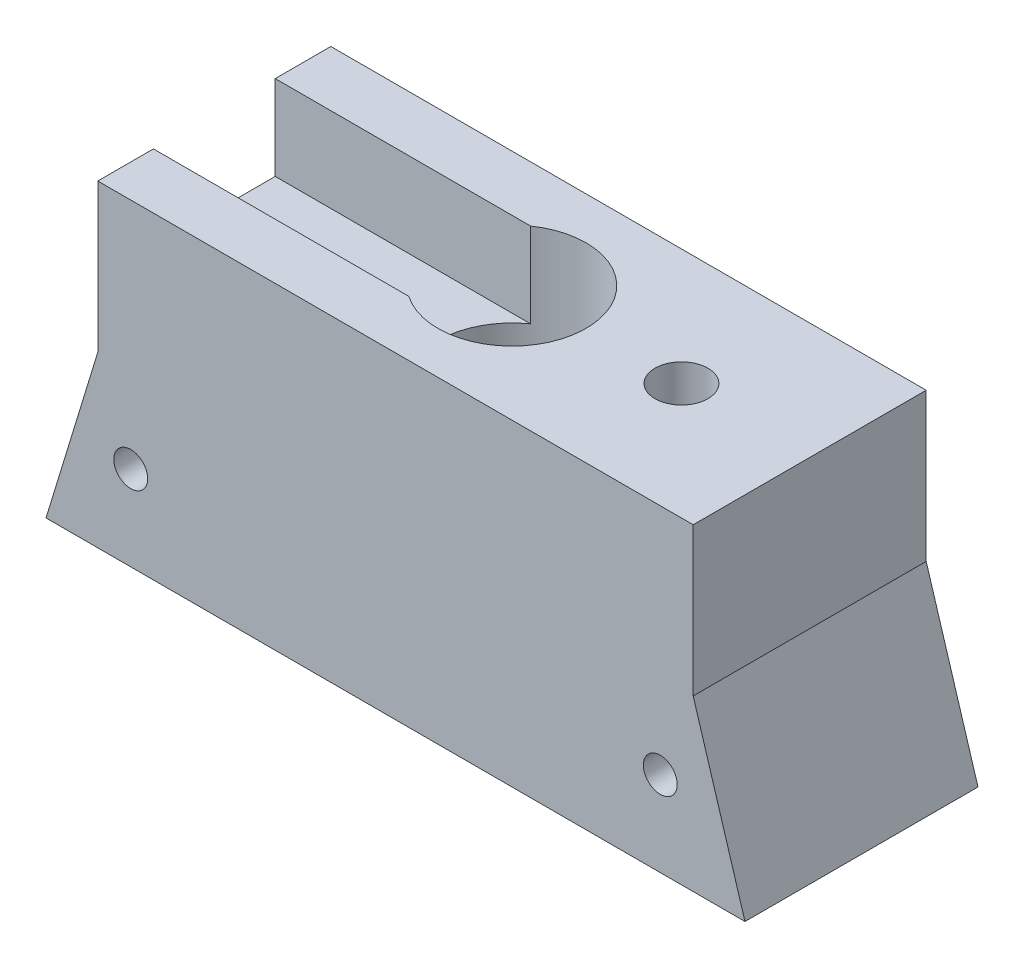
from build123d import *

# Parameters (mm, degrees)
SKETCH1_W                      = 33
SKETCH1_H                      = 11
SKETCH1_W_2                    = 30.000000000000036
SKETCH1_H_2                    = 7.99999999999994
BOSS_EXTRUDE1_DEPTH            = 8
SKETCH3_R                      = 0.8000000000000009
CUT_EXTRUDE3_DEPTH             = 22.383404780343106
CUT_EXTRUDE5_REACH             = 21.144
SKETCH5_R                      = 3.5
CUT_EXTRUDE5_DIRECTION_2_DEPTH = 20.144189719076667
CUT_EXTRUDE4_DEPTH             = 22.383404780343106
CUT_EXTRUDE9_START             = -1.5
CUT_EXTRUDE9_DEPTH             = 8
CUT_EXTRUDE8_DEPTH             = 2.25
BOSS_EXTRUDE8_START            = 3
SKETCH12_W                     = 28.108309096661426
SKETCH12_H                     = 11
SKETCH12_R                     = 3.5
BOSS_EXTRUDE8_DEPTH            = 3
CHAMFER1_SIZE                  = 3.369055161
CHAMFER1_SIZE_2                = 1.5
CHAMFER2_SIZE                  = 0.5
CHAMFER2_SIZE2                 = 1.1230183869521158
CHAMFER3_SIZE                  = 0.5
CHAMFER3_SIZE2                 = 1.1230183869521158
BOSS_EXTRUDE9_REACH            = 20.481
BOSS_EXTRUDE10_START           = 4
BOSS_EXTRUDE10_DEPTH           = 4
CUT_EXTRUDE10_REACH            = 24.967
SKETCH20_R                     = 1.2499999999999991


with BuildPart() as part:
    # Sketch1 → Boss-Extrude1 (new body)
    # profile 1 of 2: a face of its own
    with BuildSketch(Plane(origin=(0, 0, 0), x_dir=(1, 0, 0), z_dir=(0, 1, 0))):
        Rectangle(SKETCH1_W, SKETCH1_H)
        Rectangle(SKETCH1_W_2, SKETCH1_H_2, mode=Mode.SUBTRACT)
    # profile 2 of 2: a face of its own
    with BuildSketch(Plane(origin=(0, 0, 0), x_dir=(1, 0, 0), z_dir=(0, 1, 0))):
        Rectangle(SKETCH1_W_2, SKETCH1_H_2)
    extrude(amount=BOSS_EXTRUDE1_DEPTH)

    # Sketch3 → Cut-Extrude3 (cut, through all)
    with BuildSketch(Plane.XY.offset(5.50000000000003)):
        with Locations((-12.500000000000014, 4)):
            Circle(SKETCH3_R)
        with Locations((12.499999999999988, 4)):
            Circle(SKETCH3_R)
    extrude(amount=-CUT_EXTRUDE3_DEPTH, mode=Mode.SUBTRACT)

    # Sketch5 → Cut-Extrude5 (cut, up to next)
    with BuildSketch(Plane(origin=(0, 8, 0), x_dir=(1, 0, 0), z_dir=(0, 1, 0)), mode=Mode.PRIVATE) as cut_extrude5_sk1:
        with Locations(Location((0, 0, 0), (0, 0, 90))):
            Circle(SKETCH5_R)
    cut_extrude5_tool1 = extrude(cut_extrude5_sk1.sketch, amount=-CUT_EXTRUDE5_REACH, mode=Mode.PRIVATE) & part.part
    add(cut_extrude5_tool1.solids().sort_by_distance((0, 8, 0))[0], mode=Mode.SUBTRACT)

    # Sketch5 → Cut-Extrude5 direction 2 (cut)
    with BuildSketch(Plane(origin=(0, 8, 0), x_dir=(1, 0, 0), z_dir=(0, 1, 0))):
        with Locations(Location((0, 0, 0), (0, 0, 90))):
            Circle(SKETCH5_R)
    extrude(amount=CUT_EXTRUDE5_DIRECTION_2_DEPTH, mode=Mode.SUBTRACT)

    # Sketch4 → Cut-Extrude4 (cut, through all)
    with BuildSketch(Plane.XY.offset(5.50000000000003)):
        Polygon((-16.500000000000014, 0), (-14.054154548330727, 8), (-16.500000000000014, 8), align=None)
        Polygon((16.499999999999986, 0), (14.0541545483307, 8), (16.499999999999986, 8), align=None)
    extrude(amount=-CUT_EXTRUDE4_DEPTH, mode=Mode.SUBTRACT)

    # Sketch14 → Cut-Extrude9 (cut)
    with BuildSketch(Plane.XY.offset(5.50000000000003).offset(CUT_EXTRUDE9_START)):
        Polygon((-15.000000000000014, 0), (14.999999999999988, 0), (14.23567329635332, 2.5000000000000067), (-14.235673296353353, 2.500000000000003), align=None)
    extrude(amount=-CUT_EXTRUDE9_DEPTH, mode=Mode.SUBTRACT)

    # Sketch9 → Cut-Extrude8 (cut)
    with BuildSketch(Plane.XZ.offset(-2.500000000000005)):
        Polygon((-11.000000000000002, 4.000000000000002), (11.000000000000002, 4.000000000000001), (11.000000000000004, -3.999999999999999), (-11, -4.000000000000002), align=None)
    extrude(amount=-CUT_EXTRUDE8_DEPTH, mode=Mode.SUBTRACT)

    # Sketch12 → Boss-Extrude8 (add)
    with BuildSketch(Plane(origin=(0, 8, 0), x_dir=(1, 0, 0), z_dir=(0, 1, 0)).offset(BOSS_EXTRUDE8_START)):
        Rectangle(SKETCH12_W, SKETCH12_H)
        with Locations(Location((0, 0, 0), (0, 0, 90))):
            Circle(SKETCH12_R, mode=Mode.SUBTRACT)
    extrude(amount=-BOSS_EXTRUDE8_DEPTH)

    # Chamfer1
    # the kernel refuses this chamfer: 3.369055161, 1.5 mm, written as the material it takes off along each edge
    with BuildSketch(Plane(origin=(0, 4.750000000000005, 0), x_dir=(6e-17, 0, -1), z_dir=(1, 0, 6e-17))) as chamfer1_piece_1_section:
        Polygon((3.5 + CHAMFER1_SIZE, 0), (3.5, CHAMFER1_SIZE_2), (3.5, 0), align=None)
    chamfer1_piece_1 = revolve(axis=Axis((0, 4.750000000000005, 0), (0, 1, 0)), mode=Mode.PRIVATE)
    chamfer1_piece_1 = split(chamfer1_piece_1, bisect_by=Plane(origin=(-5.449382074907194, 4.96599151817854, 4.00000000000003), z_dir=(0, 0, -1)), keep=Keep.TOP, mode=Mode.PRIVATE)
    chamfer1_piece_1 = split(chamfer1_piece_1, bisect_by=Plane(origin=(-5.449382074907194, 4.96599151817854, -3.99999999999997), z_dir=(0, 0, 1)), keep=Keep.TOP, mode=Mode.PRIVATE)
    add(chamfer1_piece_1, mode=Mode.SUBTRACT)

    # Chamfer2
    chamfer2_edges = [part.edges().sort_by_distance(p)[0] for p in [
        (-11, 2.5000000000000036, 0),
    ]]
    chamfer2_side = [part.faces().sort_by_distance(p)[0] for p in [
        (-11.000000000000002, 3.625000000000003, 0),
    ]]
    chamfer(chamfer2_edges, length=CHAMFER2_SIZE, length2=CHAMFER2_SIZE2, reference=chamfer2_side[0])

    # Chamfer3
    chamfer3_edges = [part.edges().sort_by_distance(p)[0] for p in [
        (11.000000000000004, 2.500000000000006, 8.9e-16),
    ]]
    chamfer3_side = [part.faces().sort_by_distance(p)[0] for p in [
        (11.000000000000002, 3.625000000000006, 7.9e-16),
    ]]
    chamfer(chamfer3_edges, length=CHAMFER3_SIZE, length2=CHAMFER3_SIZE2, reference=chamfer3_side[0])

    # Sketch17 → Boss-Extrude9 (add, up to next)
    with BuildSketch(Plane.XZ.offset(-4.750000000000004), mode=Mode.PRIVATE) as boss_extrude9_sk1:
        Polygon((5.910492264007006, -3.500000000000001), (8.9e-16, -3.5), (-5.910492264007006, -3.500000000000001), (-5.910492264007006, -3.999999999999969), (5.910492264007006, -3.999999999999969), align=None)
    boss_extrude9_tool1 = extrude(boss_extrude9_sk1.sketch, amount=-BOSS_EXTRUDE9_REACH, mode=Mode.PRIVATE) - part.part
    add(boss_extrude9_tool1.solids().sort_by_distance((0, 4.75, -3.75))[0])

    # Sketch18 → Boss-Extrude10 (add)
    with BuildSketch(Plane(origin=(0, 11, 0), x_dir=(1, 0, 0), z_dir=(0, 1, 0)).offset(BOSS_EXTRUDE10_START)):
        with BuildLine():
            Line((-1.9960899278338715, -2.875000000000029), (-14.054154548330727, -2.875000000000029))
            Line((-14.054154548330727, -2.875000000000029), (-14.054154548330727, -5.50000000000003))
            Line((-14.054154548330729, -5.50000000000003), (14.0541545483307, -5.50000000000003))
            Line((14.0541545483307, -5.50000000000003), (14.0541545483307, -2.875000000000029))
            Line((14.054154548330702, -2.875000000000029), (1.9960899278337951, -2.875000000000029))
            ThreePointArc((1.996089927833807, -2.8750000000000746), (-3.947e-14, -3.5), (-1.9960899278338722, -2.8750000000000293))
        make_face()
        with BuildLine():
            Line((14.0541545483307, 5.499999999999971), (-14.054154548330729, 5.499999999999971))
            Line((-14.054154548330727, 5.499999999999971), (-14.054154548330727, 2.8749999999999707))
            Line((-14.054154548330727, 2.8749999999999707), (-1.9960899278339532, 2.8749999999999707))
            ThreePointArc((-1.996089927833954, 2.8749999999999725), (-4.946e-14, 3.5), (1.9960899278338722, 2.875000000000029))
            Line((1.9960899278338768, 2.8749999999999702), (14.054154548330702, 2.8749999999999702))
            Line((14.0541545483307, 2.8749999999999702), (14.0541545483307, 5.499999999999971))
        make_face()
        with BuildLine():
            Line((14.0541545483307, -2.875000000000029), (14.0541545483307, 2.87499999999997))
            Line((14.054154548330702, 2.8749999999999702), (1.9960899278338768, 2.8749999999999702))
            ThreePointArc((1.9960899278338722, 2.875000000000029), (3.1013154263488385, 1.6222954805739687), (3.5000000000000004, 0))
            ThreePointArc((3.5000000000000004, 0), (3.10131542634882, -1.622295480574004), (1.996089927833807, -2.8750000000000746))
            Line((1.9960899278337951, -2.875000000000029), (14.054154548330702, -2.875000000000029))
        make_face()
    extrude(amount=-BOSS_EXTRUDE10_DEPTH)

    # Sketch20 → Cut-Extrude10 (cut, up to next)
    with BuildSketch(Plane(origin=(0, 15, 0), x_dir=(1, 0, 0), z_dir=(0, 1, 0)), mode=Mode.PRIVATE) as cut_extrude10_sk1:
        with Locations(Location((8, 0, 0), (0, 0, 270))):
            Circle(SKETCH20_R)
    cut_extrude10_tool1 = extrude(cut_extrude10_sk1.sketch, amount=-CUT_EXTRUDE10_REACH, mode=Mode.PRIVATE) & part.part
    add(cut_extrude10_tool1.solids().sort_by_distance((8, 15, 0))[0], mode=Mode.SUBTRACT)


solid = part.part
